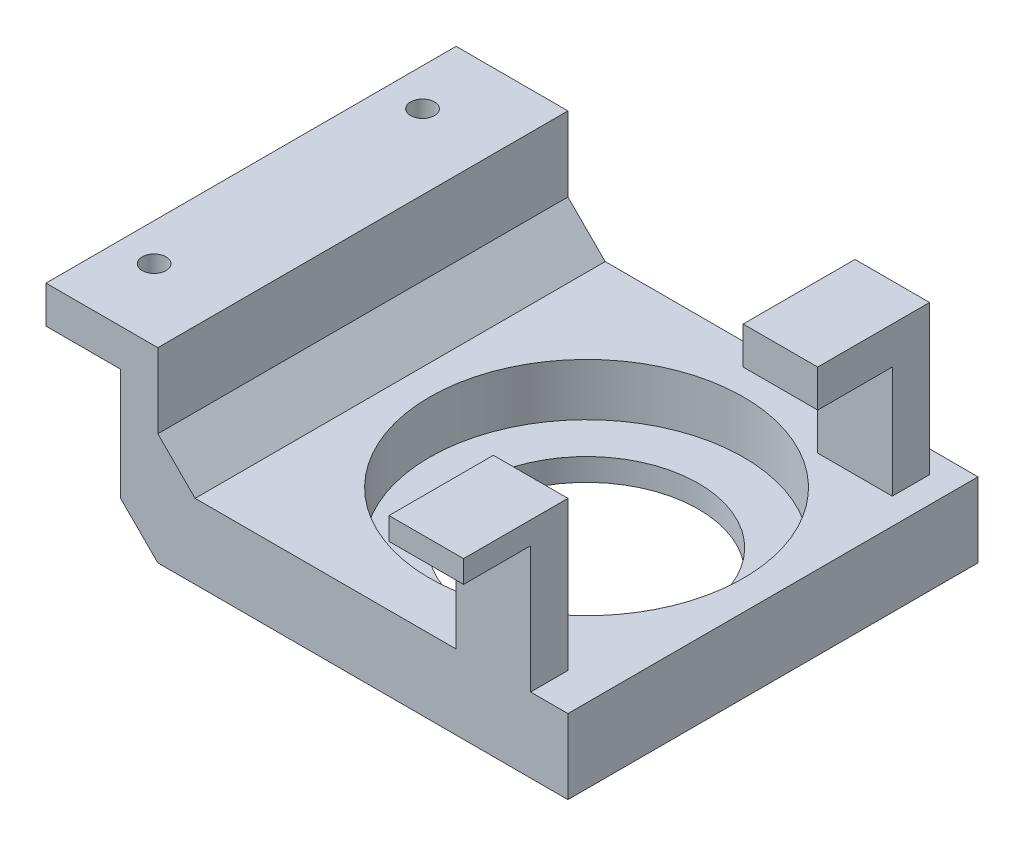
from build123d import *

# Parameters (mm, degrees)
SALIENTE_EXTRUIR2_DEPTH    = 55
CROQUIS6_R                 = 21.05
CORTAR_EXTRUIR1_DEPTH      = 7
CORTAR_EXTRUIR2_DEPTH      = 73.286420098
CORTAR_EXTRUIR2_DEPTH_BACK = 73.286420098
CROQUIS8_R                 = 15
CORTAR_EXTRUIR3_DEPTH      = 72.703044082
CORTAR_EXTRUIR3_DEPTH_BACK = 72.703044082
CROQUIS9_R                 = 1.6
CHAFL_N1_SIZE              = 5
CROQUIS11_W                = 10
CROQUIS11_H                = 5
SALIENTE_EXTRUIR3_DEPTH    = 20
CROQUIS12_W                = 10
CROQUIS12_H                = 3
SALIENTE_EXTRUIR4_DEPTH    = 9
CROQUIS13_W                = 10
CROQUIS13_H                = 5
SALIENTE_EXTRUIR5_DEPTH    = 20
CROQUIS14_W                = 10
CROQUIS14_H                = 5
SALIENTE_EXTRUIR6_DEPTH    = 10


with BuildPart() as part:
    # Croquis4 → Saliente-Extruir2 (new body)
    with BuildSketch(Plane.XY):
        Polygon((-31.428571429, 5.761904762), (-31.428571429, 14.761904762), (-41.428571429, 14.761904762), (-41.428571429, 19.761904762), (-26.428571429, 19.761904762), (-26.428571429, 4.761904762), (28.571428571, 4.761904762), (28.571428571, -5.238095238), (-31.428571429, -5.238095238), align=None)
    extrude(amount=SALIENTE_EXTRUIR2_DEPTH)

    # Croquis6 → Cortar-Extruir1 (cut)
    with BuildSketch(Plane(origin=(0, 4.761904762, 0), x_dir=(1, 0, 0), z_dir=(0, 1, 0))):
        with Locations((3.571428571, -27.5)):
            Circle(CROQUIS6_R)
    extrude(amount=-CORTAR_EXTRUIR1_DEPTH, mode=Mode.SUBTRACT)

    # Croquis8 → Cortar-Extruir2 (cut, two sides: drawn at the far end of the back side and taken through both)
    with BuildSketch(Plane(origin=(0, -2.238095238, 0), x_dir=(1, 0, 0), z_dir=(0, 1, 0)).offset(-CORTAR_EXTRUIR2_DEPTH_BACK)):
        with Locations((3.571428571, -27.5)):
            Circle(CROQUIS8_R)
    extrude(amount=CORTAR_EXTRUIR2_DEPTH + CORTAR_EXTRUIR2_DEPTH_BACK, mode=Mode.SUBTRACT)

    # Croquis9 → Cortar-Extruir3 (cut, two sides: drawn at the far end of the back side and taken through both)
    with BuildSketch(Plane.XZ.offset(-14.761904762).offset(-CORTAR_EXTRUIR3_DEPTH_BACK)):
        with Locations((-36.428571429, 45.5)):
            Circle(CROQUIS9_R)
        with Locations((-36.428571429, 9.5)):
            Circle(CROQUIS9_R)
    extrude(amount=CORTAR_EXTRUIR3_DEPTH + CORTAR_EXTRUIR3_DEPTH_BACK, mode=Mode.SUBTRACT)

    # Chaflán1
    chafl_n1_edges = [part.edges().sort_by_distance(p)[0] for p in [
        (-26.428571429, 4.761904762, 27.5),
        (-31.428571429, -5.238095238, 27.5),
    ]]
    chamfer(chafl_n1_edges, length=CHAFL_N1_SIZE)

    # Croquis11 → Saliente-Extruir3 (add)
    with BuildSketch(Plane(origin=(0, 4.761904762, 0), x_dir=(1, 0, 0), z_dir=(0, 1, 0))):
        with Locations((18.571428571, -52.5)):
            Rectangle(CROQUIS11_W, CROQUIS11_H)
    extrude(amount=SALIENTE_EXTRUIR3_DEPTH)

    # Croquis12 → Saliente-Extruir4 (add)
    with BuildSketch(Plane.XY.offset(55)):
        with Locations((18.571428571, 23.261904762)):
            Rectangle(CROQUIS12_W, CROQUIS12_H)
    extrude(amount=SALIENTE_EXTRUIR4_DEPTH)

    # Croquis13 → Saliente-Extruir5 (add)
    with BuildSketch(Plane(origin=(0, 4.761904762, 0), x_dir=(1, 0, 0), z_dir=(0, 1, 0))):
        with Locations((20.071428571, -5.5)):
            Rectangle(CROQUIS13_W, CROQUIS13_H)
    extrude(amount=SALIENTE_EXTRUIR5_DEPTH)

    # Croquis14 → Saliente-Extruir6 (add)
    with BuildSketch(Plane.XY.offset(8)):
        with Locations((20.071428571, 22.261904762)):
            Rectangle(CROQUIS14_W, CROQUIS14_H)
    extrude(amount=SALIENTE_EXTRUIR6_DEPTH)


solid = part.part
